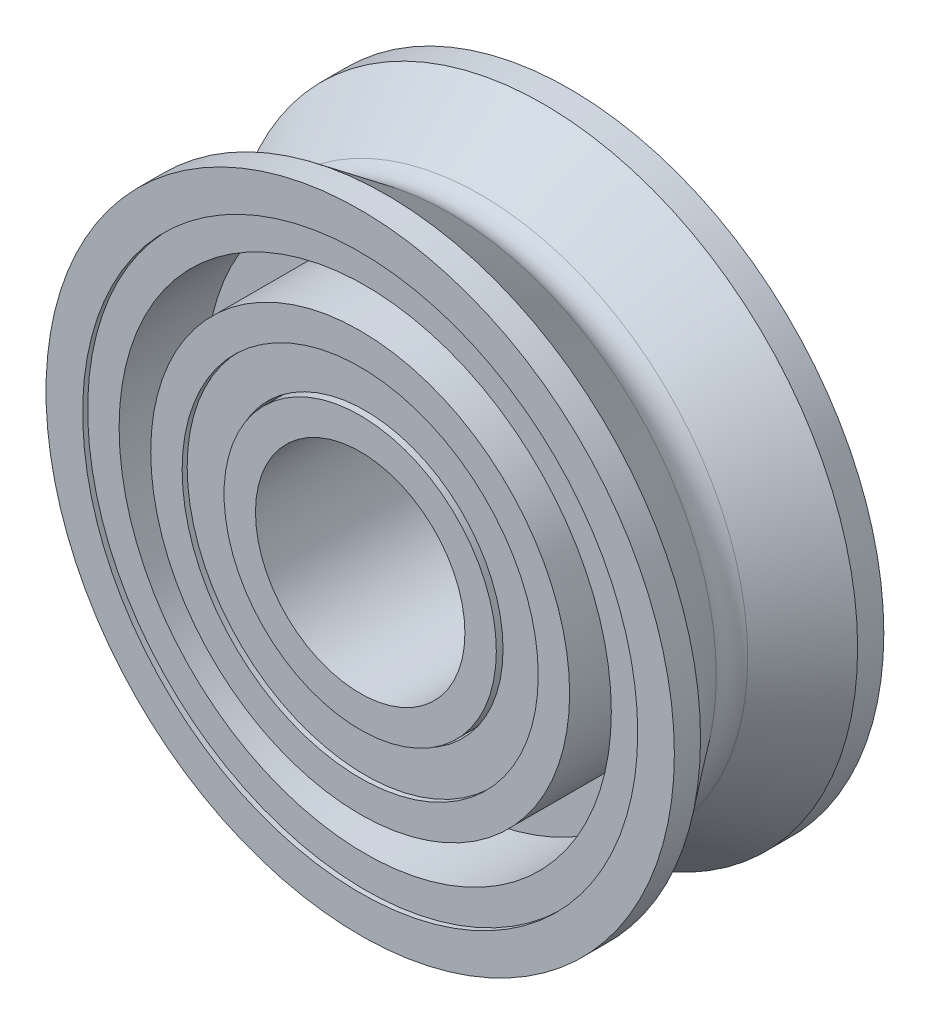
from build123d import *
from build123d.topology import SkipClean

# Parameters (mm, degrees)
CUT_EXTRUDE_THIN1_DEPTH      = 7.919752073
CUT_EXTRUDE_THIN1_DEPTH_BACK = 7.919752073
SKETCH2_R                    = 2.08915
SKETCH2_R_2                  = 2.06375


with BuildPart() as part:
    # Sketch1 → Revolve1 (revolve)
    with BuildSketch(Plane(origin=(0, 0, 0), x_dir=(0, 0, -1), z_dir=(1, 0, 0))):
        with BuildLine():
            Line((1.190625, 4.7625), (1.5875, 4.7625))
            Line((1.5875, 4.7625), (1.5875, 4.206875))
            Line((1.5875, 4.206875), (1.5113, 4.206875))
            Line((1.5113, 4.206875), (1.5113, 3.730625))
            Line((1.5113, 3.730625), (0.1984375, 3.730625))
            Line((0.1984375, 3.730625), (0.1984375, 3.175))
            Line((0.1984375, 3.175), (1.5875, 3.175))
            Line((1.5875, 3.175), (1.5875, 2.69875))
            Line((1.5875, 2.69875), (1.5113, 2.69875))
            Line((1.5113, 2.69875), (1.5113, 2.06375))
            Line((1.5113, 2.06375), (1.5875, 2.06375))
            Line((1.5875, 2.06375), (1.5875, 1.5875))
            Line((1.5875, 1.5875), (-1.5875, 1.5875))
            Line((-1.5875, 1.5875), (-1.5875, 2.06375))
            Line((-1.5875, 2.06375), (-1.5113, 2.06375))
            Line((-1.5113, 2.06375), (-1.5113, 2.69875))
            Line((-1.5113, 2.69875), (-1.5875, 2.69875))
            Line((-1.5875, 2.69875), (-1.5875, 3.175))
            Line((-1.5875, 3.175), (-0.1984375, 3.175))
            Line((-0.1984375, 3.175), (-0.1984375, 3.730625))
            Line((-0.1984375, 3.730625), (-1.5113, 3.730625))
            Line((-1.5113, 3.730625), (-1.5113, 4.206875))
            Line((-1.5113, 4.206875), (-1.5875, 4.206875))
            Line((-1.5875, 4.206875), (-1.5875, 4.7625))
            Line((-1.5875, 4.7625), (-1.190625, 4.7625))
            Line((-1.190625, 4.7625), (-0.238125, 4.048125))
            ThreePointArc((-0.238125, 4.048125), (0, 3.96875), (0.238125, 4.048125))
            Line((0.238125, 4.048125), (1.190625, 4.7625))
        make_face()
    revolve(axis=Axis((0, 0, 1.5875), (0, 0, -1)))

    # Sketch2 → Cut-Extrude-Thin1 (cut, two sides: drawn at the far end of the back side and taken through both)
    with SkipClean():  # the faces are left unmerged after this step: merging them gives an invalid solid
        with BuildSketch(Plane.XY.offset(-CUT_EXTRUDE_THIN1_DEPTH_BACK)):
            Circle(SKETCH2_R)
            Circle(SKETCH2_R_2, mode=Mode.SUBTRACT)
        extrude(amount=CUT_EXTRUDE_THIN1_DEPTH + CUT_EXTRUDE_THIN1_DEPTH_BACK, mode=Mode.SUBTRACT)


with BuildPart() as cut_extrude_thin1_piece_1:
    # of the separate pieces the step leaves, piece 1, a body of its own (cut_extrude_thin1_pieces)
    add(part.part.solids().sort_by_distance((0, 4.048125, 0.238125))[0])


with BuildPart() as cut_extrude_thin1_piece_2:
    # of the separate pieces the step leaves, piece 2, a body of its own (cut_extrude_thin1_pieces)
    add(part.part.solids().sort_by_distance((0, 2.06375, 1.5875))[0])


solid = Compound([cut_extrude_thin1_piece_1.part, cut_extrude_thin1_piece_2.part])
